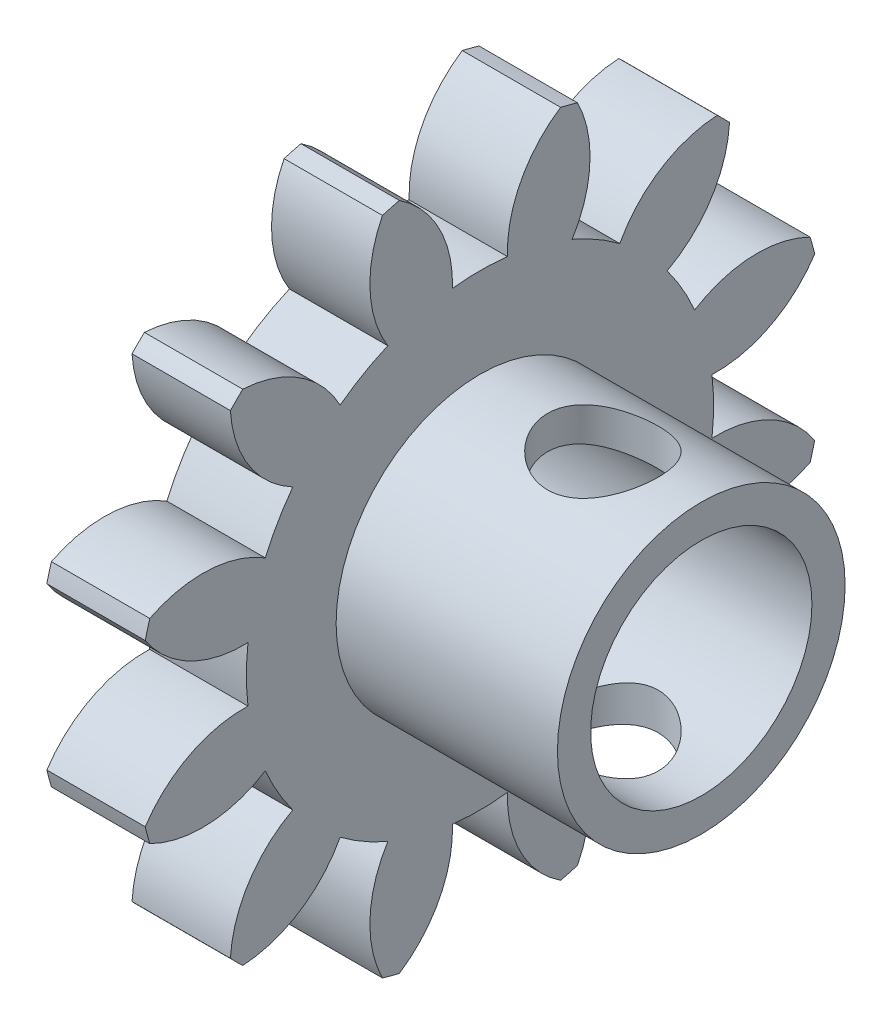
from build123d import *

# Parameters (mm, degrees)
SPUR_START             = -273.054421635
SPUR_GEAR_AM_OUTLINE_R = 9.525
SPUR_GEAR_AM_DEPTH     = 12.7
SCALE2_SCALE           = 0.7
SKETCH5_R              = 10
CUT_EXTRUDE2_DEPTH     = 141.883332495
BOSS_EXTRUDE1_START    = 20
SKETCH7_R              = 13
SKETCH7_R_2            = 10
BOSS_EXTRUDE1_DEPTH    = 20
SKETCH8_R              = 5
CUT_EXTRUDE3_DEPTH     = 306.435901832


# Read off the part's stored shape, not the designer's step: spur gear_am
with BuildPart() as part:
    # spur gear_am outline → spur gear_am (new body)
    with BuildSketch(Plane.YZ.offset(SPUR_START)):
        with BuildLine():
            ThreePointArc((116.546862005, 16.732254346), (117.355063047, 17.520188248), (118.142996949, 18.32838929))
            ThreePointArc((118.142996949, 18.32838929), (115.759708054, 25.667921311), (110.086646287, 30.899093879))
            ThreePointArc((110.086646287, 30.899093879), (112.044558013, 33.870469671), (113.638889071, 37.05175886))
            ThreePointArc((113.638889071, 37.05175886), (121.00574829, 34.754329537), (128.553613919, 36.360106821))
            ThreePointArc((128.553613919, 36.360106821), (128.859569602, 37.446578117), (129.137839856, 38.540467701))
            ThreePointArc((129.137839856, 38.540467701), (123.404085119, 43.705044437), (115.875483227, 45.398841888))
            ThreePointArc((115.875483227, 45.398841888), (116.085396623, 48.951084671), (115.875483227, 52.503327455))
            ThreePointArc((115.875483227, 52.503327455), (123.404085118, 54.197124907), (129.137839856, 59.361701642))
            ThreePointArc((129.137839856, 59.361701642), (128.859569602, 60.455591227), (128.553613919, 61.542062523))
            ThreePointArc((128.553613919, 61.542062523), (121.00574829, 63.147839807), (113.638889071, 60.850410483))
            ThreePointArc((113.638889071, 60.850410483), (112.044558013, 64.031699672), (110.086646287, 67.003075464))
            ThreePointArc((110.086646287, 67.003075464), (115.759708054, 72.234248032), (118.142996949, 79.573780054))
            ThreePointArc((118.142996949, 79.573780054), (117.355063047, 80.381981095), (116.546862005, 81.169914997))
            ThreePointArc((116.546862005, 81.169914997), (109.207329984, 78.786626103), (103.976157416, 73.113564336))
            ThreePointArc((103.976157416, 73.113564336), (101.004781623, 75.071476061), (97.823492434, 76.665807119))
            ThreePointArc((97.823492434, 76.665807119), (100.120921758, 84.032666338), (98.515144474, 91.580531968))
            ThreePointArc((98.515144474, 91.580531968), (97.428673178, 91.88648765), (96.334783594, 92.164757905))
            ThreePointArc((96.334783594, 92.164757905), (91.170206858, 86.431003167), (89.476409406, 78.902401276))
            ThreePointArc((89.476409406, 78.902401276), (85.924166623, 79.112314672), (82.37192384, 78.902401276))
            ThreePointArc((82.37192384, 78.902401276), (80.678126388, 86.431003167), (75.513549653, 92.164757905))
            ThreePointArc((75.513549653, 92.164757905), (74.419660069, 91.88648765), (73.333188772, 91.580531968))
            ThreePointArc((73.333188772, 91.580531968), (71.727411488, 84.032666338), (74.024840812, 76.665807119))
            ThreePointArc((74.024840812, 76.665807119), (70.843551623, 75.071476061), (67.87217583, 73.113564336))
            ThreePointArc((67.87217583, 73.113564336), (62.641003263, 78.786626103), (55.301471241, 81.169914997))
            ThreePointArc((55.301471241, 81.169914997), (54.493270199, 80.381981096), (53.705336298, 79.573780054))
            ThreePointArc((53.705336298, 79.573780054), (56.088625192, 72.234248032), (61.761686959, 67.003075464))
            ThreePointArc((61.761686959, 67.003075464), (59.803775234, 64.031699671), (58.209444175, 60.850410483))
            ThreePointArc((58.209444175, 60.850410483), (50.842584956, 63.147839807), (43.294719327, 61.542062523))
            ThreePointArc((43.294719327, 61.542062523), (42.988763645, 60.455591226), (42.71049339, 59.361701642))
            ThreePointArc((42.71049339, 59.361701642), (48.444248128, 54.197124907), (55.972850019, 52.503327455))
            ThreePointArc((55.972850019, 52.503327455), (55.762936623, 48.951084671), (55.972850019, 45.398841888))
            ThreePointArc((55.972850019, 45.398841888), (48.444248127, 43.705044437), (42.71049339, 38.540467701))
            ThreePointArc((42.71049339, 38.540467701), (42.988763645, 37.446578117), (43.294719327, 36.360106821))
            ThreePointArc((43.294719327, 36.360106821), (50.842584956, 34.754329537), (58.209444175, 37.05175886))
            ThreePointArc((58.209444175, 37.05175886), (59.803775234, 33.870469672), (61.761686959, 30.899093879))
            ThreePointArc((61.761686959, 30.899093879), (56.088625192, 25.667921311), (53.705336298, 18.32838929))
            ThreePointArc((53.705336298, 18.32838929), (54.493270199, 17.520188248), (55.301471241, 16.732254346))
            ThreePointArc((55.301471241, 16.732254346), (62.641003263, 19.11554324), (67.87217583, 24.788605007))
            ThreePointArc((67.87217583, 24.788605007), (70.843551623, 22.830693282), (74.024840812, 21.236362224))
            ThreePointArc((74.024840812, 21.236362224), (71.727411488, 13.869503005), (73.333188772, 6.321637376))
            ThreePointArc((73.333188772, 6.321637376), (74.419660068, 6.015681693), (75.513549653, 5.737411439))
            ThreePointArc((75.513549653, 5.737411439), (80.678126388, 11.471166177), (82.37192384, 18.999768068))
            ThreePointArc((82.37192384, 18.999768068), (85.924166623, 18.789854672), (89.476409406, 18.999768068))
            ThreePointArc((89.476409406, 18.999768068), (91.170206858, 11.471166176), (96.334783594, 5.737411439))
            ThreePointArc((96.334783594, 5.737411439), (97.428673178, 6.015681693), (98.515144474, 6.321637376))
            ThreePointArc((98.515144474, 6.321637376), (100.120921758, 13.869503005), (97.823492434, 21.236362224))
            ThreePointArc((97.823492434, 21.236362224), (101.004781623, 22.830693282), (103.976157416, 24.788605007))
            ThreePointArc((103.976157416, 24.788605007), (109.207329984, 19.11554324), (116.546862005, 16.732254346))
        make_face()
        with Locations((85.924166623, 48.951084672)):
            Circle(SPUR_GEAR_AM_OUTLINE_R, mode=Mode.SUBTRACT)
    extrude(amount=SPUR_GEAR_AM_DEPTH)


with BuildPart() as part_1:
    # Scale2: scaled about (-266.704421635, 85.924166623, 48.951084672)
    add(part.part.scale(SCALE2_SCALE).moved(Location((-80.011326491, 25.777249987, 14.685325402))))

    # Sketch5 → Cut-Extrude2 (cut, through all)
    with BuildSketch(Plane(origin=(-262.259421635, 0, 0), x_dir=(0, 0, -1), z_dir=(1, 0, 0))):
        with Locations((-48.951084672, 85.924166623)):
            Circle(SKETCH5_R)
    extrude(amount=-CUT_EXTRUDE2_DEPTH, mode=Mode.SUBTRACT)

    # Sketch7 → Boss-Extrude1 (add)
    with BuildSketch(Plane(origin=(-262.259421635, 0, 0), x_dir=(0, 0, -1), z_dir=(1, 0, 0)).offset(BOSS_EXTRUDE1_START)):
        with Locations(Location((-48.951084672, 85.924166623, 0), (0, 0, 180))):
            Circle(SKETCH7_R)
        with Locations((-48.951084672, 85.924166623)):
            Circle(SKETCH7_R_2, mode=Mode.SUBTRACT)
    extrude(amount=-BOSS_EXTRUDE1_DEPTH)

    # Sketch8 → Cut-Extrude3 (cut, through all)
    with BuildSketch(Plane(origin=(0, 0, 0), x_dir=(1, 0, 0), z_dir=(0, 1, 0))):
        with Locations(Location((-251.149421635, -48.951084672, 0), (0, 0, 90))):
            Circle(SKETCH8_R)
    extrude(amount=CUT_EXTRUDE3_DEPTH, mode=Mode.SUBTRACT)


solid = part_1.part
